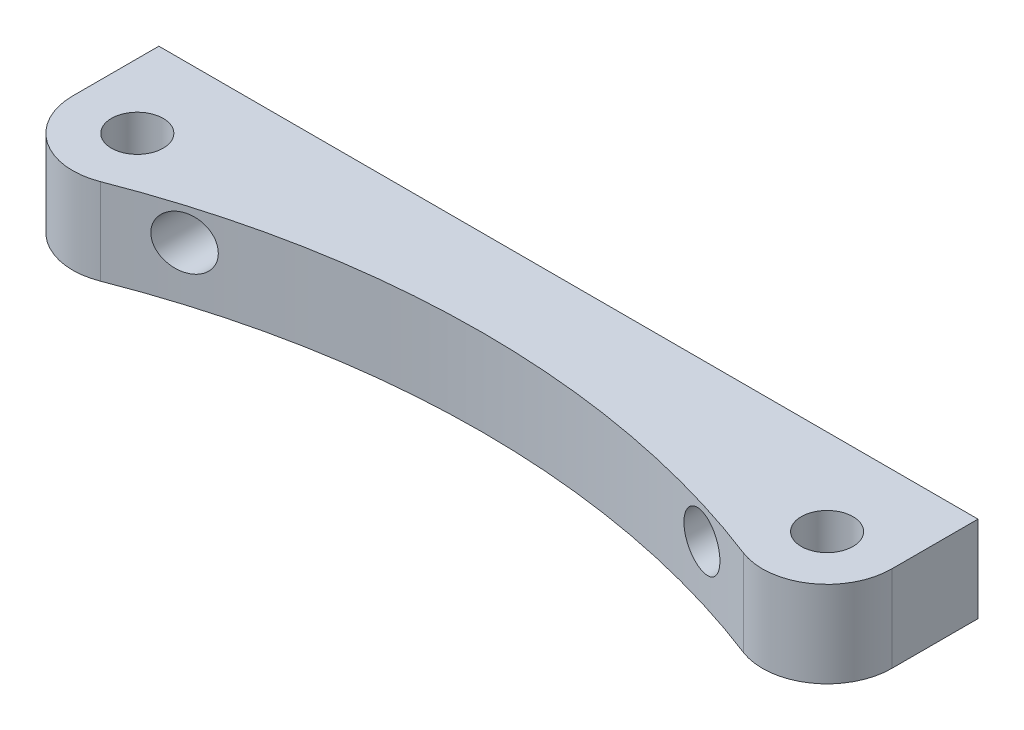
from build123d import *

# Parameters (mm, degrees)
SKETCH1_R           = 1.905
BOSS_EXTRUDE1_DEPTH = 6.35
CUT_EXTRUDE1_REACH  = 59.018
SKETCH2_R           = 1.905


with BuildPart() as part:
    # Sketch1 → Boss-Extrude1 (new body)
    with BuildSketch(Plane(origin=(0, 0, 0), x_dir=(1, 0, 0), z_dir=(0, 1, 0))):
        with BuildLine():
            Line((-4.7625, 6.35), (-4.7625, 0))
            ThreePointArc((-4.7625, 0), (-2.689307148, -3.930525832), (1.725283019, -4.439009434))
            ThreePointArc((1.725283019, -4.439009434), (25.4, 0), (49.074716981, -4.439009434))
            ThreePointArc((49.074716981, -4.439009434), (53.489307148, -3.930525832), (55.5625, 0))
            Line((55.5625, 0), (55.5625, 6.35))
            Line((55.5625, 6.35), (-4.7625, 6.35))
        make_face()
        Circle(SKETCH1_R, mode=Mode.SUBTRACT)
        with Locations((50.8, 0)):
            Circle(SKETCH1_R, mode=Mode.SUBTRACT)
    extrude(amount=BOSS_EXTRUDE1_DEPTH)

    # Sketch2 → Cut-Extrude1 (cut, up to next)
    with BuildSketch(Plane(origin=(0, 0, -6.35), x_dir=(-1, 0, 0), z_dir=(0, 0, -1)), mode=Mode.PRIVATE) as cut_extrude1_sk1:
        with Locations((-44.45, 3.96875)):
            Circle(SKETCH2_R)
    cut_extrude1_tool1 = extrude(cut_extrude1_sk1.sketch, amount=-CUT_EXTRUDE1_REACH, mode=Mode.PRIVATE) & part.part
    # Sketch2 → Cut-Extrude1 (cut, up to next)
    with BuildSketch(Plane(origin=(0, 0, -6.35), x_dir=(-1, 0, 0), z_dir=(0, 0, -1)), mode=Mode.PRIVATE) as cut_extrude1_sk2:
        with Locations((-6.35, 3.96875)):
            Circle(SKETCH2_R)
    cut_extrude1_tool2 = extrude(cut_extrude1_sk2.sketch, amount=-CUT_EXTRUDE1_REACH, mode=Mode.PRIVATE) & part.part
    add(cut_extrude1_tool1.solids().sort_by_distance((44.45, 3.96875, -6.35))[0], mode=Mode.SUBTRACT)
    add(cut_extrude1_tool2.solids().sort_by_distance((6.35, 3.96875, -6.35))[0], mode=Mode.SUBTRACT)


solid = part.part
